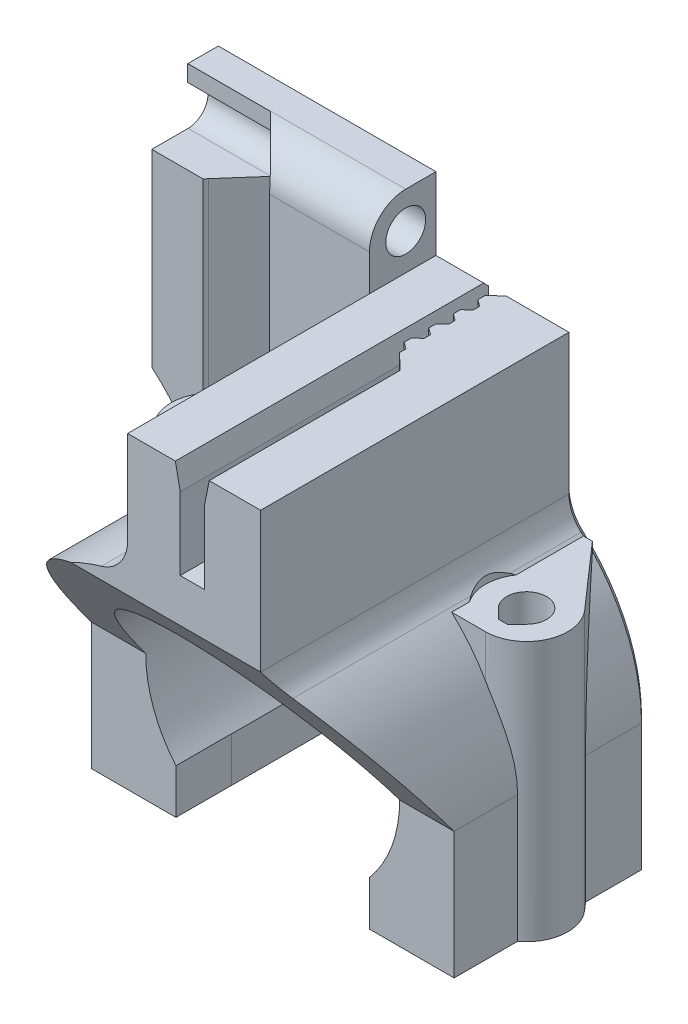
from build123d import *
from OCP.BRepFilletAPI import BRepFilletAPI_MakeChamfer

# Parameters (mm, degrees)
BOSS_EXTRUDE1_DEPTH     = 26
BOSS_EXTRUDE2_DEPTH     = 21.5
SKETCH2_R               = 1.65
CUT_EXTRUDE1_DEPTH      = 47.959663633
CUT_EXTRUDE3_DEPTH      = 47.959663633
CUT_EXTRUDE4_DEPTH      = 8
BOSS_EXTRUDE4_DEPTH     = 6
CUT_EXTRUDE5_DEPTH      = 46.133136488
CUT_EXTRUDE5_DEPTH_BACK = 46.133136488
CUT_EXTRUDE6_DEPTH      = 40.22053051
CHAMFER1_SIZE           = 0.4
CHAMFER1_SIZE2          = 2
FILLET1_R               = 3
SKETCH14_R              = 1.65
CUT_EXTRUDE8_DEPTH      = 45.447272302
CUT_EXTRUDE9_START      = -6.838886
CUT_EXTRUDE9_DEPTH      = 6.838886
CHAMFER2_SIZE           = 0.5
SKETCH16_R              = 10.5
CUT_EXTRUDE11_DEPTH     = 46.133136556


with BuildPart() as part:
    # Sketch1 → Boss-Extrude1 (new body)
    with BuildSketch(Plane.XY):
        with BuildLine():
            Line((8, -6.800735254), (8, -10.5))
            Line((8, -10.5), (15, -10.5))
            Line((15, -10.5), (15, 0))
            ThreePointArc((15, 0), (13.693063938, 6.123724357), (10, 11.180339887))
            ThreePointArc((10, 11.180339887), (9.261387212, 12.191662994), (9, 13.416407865))
            Line((9, 13.416407865), (9, 25))
            Line((9, 25), (-2, 25))
            Line((-2, 25), (-2, 17.291616466))
            ThreePointArc((-2, 17.291616466), (-2.602084238, 15.488840828), (-4.166666667, 14.409680388))
            ThreePointArc((-4.166666667, 14.409680388), (-11.989578808, 9.013878189), (-15, 0))
            Line((-15, 0), (-15, -10.5))
            Line((-15, -10.5), (-8, -10.5))
            Line((-8, -10.5), (-8, -6.800735254))
            ThreePointArc((-8, -6.800735254), (0, 10.5), (8, -6.800735254))
        make_face()
    extrude(amount=BOSS_EXTRUDE1_DEPTH)

    # Sketch4 → Boss-Extrude2 (add)
    with BuildSketch(Plane.XZ.offset(10.5)):
        with BuildLine():
            Line((10.939046488, 0.5), (7.993114887, 0.5))
            Line((7.993114887, 0.5), (7.993114887, 11.4))
            Line((7.993114887, 11.4), (13, 11.4))
            ThreePointArc((13, 11.4), (16.097379403, 9.402227098), (15.554840783, 5.756612255))
            Line((15.554840783, 5.756612255), (10.939046488, 0.5))
        make_face()
    boss_extrude2 = extrude(amount=-BOSS_EXTRUDE2_DEPTH)

    # Sketch2 → Cut-Extrude1 (cut, through all)
    with BuildSketch(Plane.XZ.offset(10.5)):
        with Locations(Location((13, 8, 0), (0, 0, 270))):
            Circle(SKETCH2_R)
    cut_extrude1 = extrude(amount=-CUT_EXTRUDE1_DEPTH, mode=Mode.SUBTRACT)

    # Mirror1: Boss-Extrude2, Cut-Extrude1 across plane
    add(boss_extrude2.mirror(Plane(origin=(0, 0, 0), x_dir=(0, 0, 1), z_dir=(1, 0, 0))))
    add(cut_extrude1.mirror(Plane(origin=(0, 0, 0), x_dir=(0, 0, 1), z_dir=(1, 0, 0))), mode=Mode.SUBTRACT)

    # Sketch5 → Cut-Extrude3 (cut, through all)
    with BuildSketch(Plane.XZ.offset(10.5)):
        Polygon((-13, 8), (-11.833273811, 9.166726189), (-12.636547622, 9.97), (-13.363452378, 9.97), (-14.166726189, 9.166726189), align=None)
        Polygon((13, 8), (14.166726189, 9.166726189), (13.363452378, 9.97), (12.636547622, 9.97), (11.833273811, 9.166726189), align=None)
    extrude(amount=-CUT_EXTRUDE3_DEPTH, mode=Mode.SUBTRACT)

    # Sketch7 → Cut-Extrude4 (cut)
    with BuildSketch(Plane(origin=(0, 25, 0), x_dir=(1, 0, 0), z_dir=(0, 1, 0))):
        Polygon((3.45, -2.334025404), (2.9, -1.934025404), (2.9, -1.334025404), (4.35, 0), (2.35, 0), (2.35, -26), (4.35, -26), (4.35, -9.828050808), (3.45, -8.962025404), (3.45, -8.430025404), (2.9, -8.030025404), (2.9, -7.430025404), (3.45, -6.930025404), (3.45, -6.398025404), (2.9, -5.998025404), (2.9, -5.398025404), (3.45, -4.898025404), (3.45, -4.366025404), (2.9, -3.966025404), (2.9, -3.366025404), (3.45, -2.866025404), align=None)
    extrude(amount=-CUT_EXTRUDE4_DEPTH, mode=Mode.SUBTRACT)

    # Sketch13 → Boss-Extrude4 (add)
    with BuildSketch(Plane(origin=(0, 0, 0), x_dir=(-1, 0, 0), z_dir=(0, 0, -1))):
        with BuildLine():
            Line((2, 17.291616466), (2, 31))
            Line((2, 31), (20, 31))
            Line((20, 31), (20, 10.739340537))
            ThreePointArc((20, 10.739340537), (16.311261475, 5.923120697), (15, 0))
            ThreePointArc((15, 0), (11.989578808, 9.013878189), (4.166666667, 14.409680388))
            ThreePointArc((4.166666667, 14.409680388), (2.602084238, 15.488840828), (2, 17.291616466))
        make_face()
    extrude(amount=-BOSS_EXTRUDE4_DEPTH)

    # Sketch9 → Cut-Extrude5 (cut, two sides: drawn at the far end of the back side and taken through both)
    with BuildSketch(Plane(origin=(0, 0, 0), x_dir=(0, 0, -1), z_dir=(1, 0, 0)).offset(-CUT_EXTRUDE5_DEPTH_BACK)):
        Polygon((-26, 13.416407865), (-16, 0), (-16, -10.5), (-26, -10.5), align=None)
    extrude(amount=CUT_EXTRUDE5_DEPTH + CUT_EXTRUDE5_DEPTH_BACK, mode=Mode.SUBTRACT)

    # Sketch10 → Cut-Extrude6 (cut, through all)
    with BuildSketch(Plane(origin=(0, 11, 0), x_dir=(1, 0, 0), z_dir=(0, 1, 0))):
        with BuildLine():
            Line((-10.595836944, -10.404163056), (-16.4, -16.208326112))
            Line((-16.4, -16.208326112), (-16.4, -8))
            ThreePointArc((-16.4, -8), (-16.181702269, -6.80134631), (-15.554840783, -5.756612255))
            Line((-15.554840783, -5.756612255), (-13.161113653, -3.030560235))
            Line((-13.161113653, -3.030560235), (-10.595836944, -5.595836944))
            ThreePointArc((-10.595836944, -5.595836944), (-9.6, -8), (-10.595836944, -10.404163056))
        make_face()
        with BuildLine():
            Line((16.4, -8), (16.4, -16.208326112))
            Line((16.4, -16.208326112), (10.595836944, -10.404163056))
            ThreePointArc((10.595836944, -10.404163056), (9.6, -8), (10.595836944, -5.595836944))
            Line((10.595836944, -5.595836944), (13.161113653, -3.030560235))
            Line((13.161113653, -3.030560235), (15.554840783, -5.756612255))
            ThreePointArc((15.554840783, -5.756612255), (16.181702269, -6.80134631), (16.4, -8))
        make_face()
    extrude(amount=CUT_EXTRUDE6_DEPTH, mode=Mode.SUBTRACT)

    # Chamfer1: one chamfer whose edges measure the first distance from different faces: ONE call of the kernel's chamfer builder (chamfer() names one face for all edges)
    chamfer1_edges_1 = [part.edges().sort_by_distance(p)[0] for p in [
        (2.35, 25, 13),
    ]]
    chamfer1_side_1 = [part.faces().sort_by_distance(p)[0] for p in [
        (0.175, 25, 13),
    ]]
    chamfer1_edges_2 = [part.edges().sort_by_distance(p)[0] for p in [
        (4.35, 25, 17.914025404),
    ]]
    chamfer1_side_2 = [part.faces().sort_by_distance(p)[0] for p in [
        (6.444101984, 25, 12.35463374),
    ]]
    chamfer1 = BRepFilletAPI_MakeChamfer(part.part.solid().wrapped)
    for e in chamfer1_edges_1:
        chamfer1.Add(CHAMFER1_SIZE, CHAMFER1_SIZE2, e.wrapped, chamfer1_side_1[0].wrapped)  # the first distance lies on this face
    for e in chamfer1_edges_2:
        chamfer1.Add(CHAMFER1_SIZE, CHAMFER1_SIZE2, e.wrapped, chamfer1_side_2[0].wrapped)  # the first distance lies on this face
    add(Compound.cast(chamfer1.Shape()), mode=Mode.REPLACE)

    # Fillet1
    fillet1_edges = [part.edges().sort_by_distance(p)[0] for p in [
        (-6.125227292, 31, 6),
    ]]
    fillet(fillet1_edges, radius=FILLET1_R)

    # Sketch14 → Cut-Extrude8 (cut, through all)
    with BuildSketch(Plane(origin=(-2, 0, 0), x_dir=(0, 0, -1), z_dir=(1, 0, 0))):
        with Locations(Location((-3, 28, 0), (0, 0, 90))):
            Circle(SKETCH14_R)
    extrude(amount=-CUT_EXTRUDE8_DEPTH, mode=Mode.SUBTRACT)

    # Sketch15 → Cut-Extrude9 (cut)
    with BuildSketch(Plane.ZY.offset(20).offset(CUT_EXTRUDE9_START)):
        with BuildLine():
            Line((3, 26.35), (6, 26.35))
            Line((6, 26.35), (6, 31))
            Line((6, 31), (3.030560235, 31))
            Line((3.030560235, 31), (3.030560235, 29.649716967))
            ThreePointArc((3.030560235, 29.649716967), (1.35007076, 28.015280773), (3, 26.35))
        make_face()
    extrude(amount=CUT_EXTRUDE9_DEPTH, mode=Mode.SUBTRACT)

    # Chamfer2
    chamfer2_edges = [part.edges().sort_by_distance(p)[0] for p in [
        (-20, 20.869670268, 0),
    ]]
    chamfer(chamfer2_edges, length=CHAMFER2_SIZE)
    chamfer2_2_edges = [part.edges().sort_by_distance(p)[0] for p in [
        (6.675, 25, 0),
    ]]
    chamfer(chamfer2_2_edges, length=CHAMFER2_SIZE)
    chamfer2_3_edges = [part.edges().sort_by_distance(p)[0] for p in [
        (9, 18.958203932, 0),
        (9.261387212, 12.191662994, 0),
        (13.693063938, 6.123724357, 0),
        (15, -5.25, 0),
    ]]
    chamfer(chamfer2_3_edges, length=CHAMFER2_SIZE - 0.0001)  # a hair under: the kernel refuses the full size
    chamfer2_4_edges = [part.edges().sort_by_distance(p)[0] for p in [
        (11.25005, -10.5, 0),
    ]]
    chamfer(chamfer2_4_edges, length=CHAMFER2_SIZE)
    chamfer2_5_edges = [part.edges().sort_by_distance(p)[0] for p in [
        (8, -8.400367627, 0),
    ]]
    chamfer(chamfer2_5_edges, length=CHAMFER2_SIZE - 0.0001)  # a hair under: the kernel refuses the full size
    chamfer2_6_edges = [part.edges().sort_by_distance(p)[0] for p in [
        (-0.404545821, 10.4922039, 0),
    ]]
    chamfer(chamfer2_6_edges, length=CHAMFER2_SIZE - 0.0001)  # a hair under: the kernel refuses the full size
    chamfer2_7_edges = [part.edges().sort_by_distance(p)[0] for p in [
        (-8, -9.024844368, 0),
    ]]
    chamfer(chamfer2_7_edges, length=CHAMFER2_SIZE - 0.0001)  # a hair under: the kernel refuses the full size
    chamfer2_8_edges = [part.edges().sort_by_distance(p)[0] for p in [
        (-11.74995, -10.5, 0),
    ]]
    chamfer(chamfer2_8_edges, length=CHAMFER2_SIZE)
    chamfer2_9_edges = [part.edges().sort_by_distance(p)[0] for p in [
        (-15, -5, 0),
        (-16.174116971, 5.619165678, 0),
    ]]
    chamfer(chamfer2_9_edges, length=CHAMFER2_SIZE)
    chamfer2_10_edges = [part.edges().sort_by_distance(p)[0] for p in [
        (3.35, 17, 0),
    ]]
    chamfer(chamfer2_10_edges, length=CHAMFER2_SIZE)
    chamfer2_11_edges = [part.edges().sort_by_distance(p)[0] for p in [
        (2.35, 20, 0),
    ]]
    chamfer(chamfer2_11_edges, length=CHAMFER2_SIZE)
    chamfer2_12_edges = [part.edges().sort_by_distance(p)[0] for p in [
        (-0.075, 25, 0),
    ]]
    chamfer(chamfer2_12_edges, length=CHAMFER2_SIZE)
    chamfer2_13_edges = [part.edges().sort_by_distance(p)[0] for p in [
        (-2, 28, 0),
    ]]
    chamfer(chamfer2_13_edges, length=CHAMFER2_SIZE)
    chamfer2_14_edges = [part.edges().sort_by_distance(p)[0] for p in [
        (-11, 31, 0),
    ]]
    chamfer(chamfer2_14_edges, length=CHAMFER2_SIZE)

    # Sketch16 → Cut-Extrude11 (cut, through all)
    with BuildSketch(Plane.XY):
        Circle(SKETCH16_R)
    extrude(amount=CUT_EXTRUDE11_DEPTH, mode=Mode.SUBTRACT)


solid = part.part
